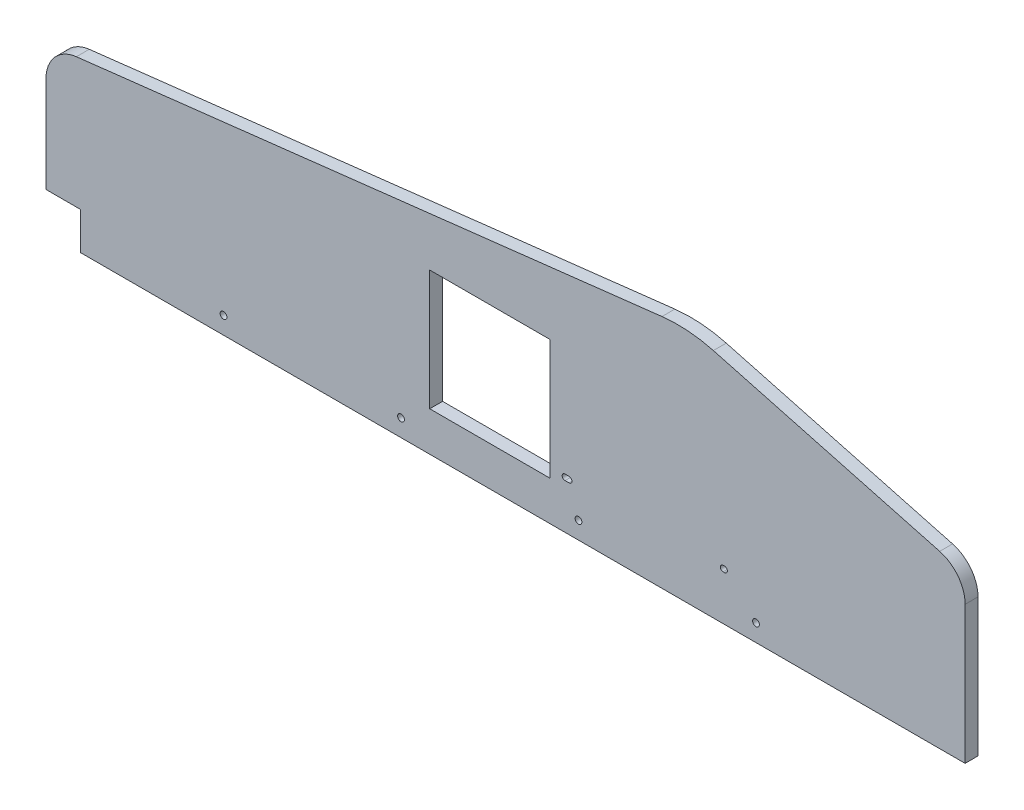
from build123d import *

# Parameters (mm, degrees)
BOSS_EXTRUDE1_DEPTH         = 4.7625
FILLET1_R                   = 25.4
FILLET2_R                   = 101.6
SKETCH3_W                   = 25.4
SKETCH3_H                   = 27.686
CUT_EXTRUDE1_DEPTH          = 383.440406717
SKETCH5_W                   = 88.9
SKETCH5_H                   = 88.9
CUT_EXTRUDE2_DEPTH          = 383.440406717
TAP_DRILL_FOR_M6X1_0_TAP1_D = 5
CUT_EXTRUDE3_DEPTH          = 383.440406717


with BuildPart() as part:
    # Sketch2 → Boss-Extrude1 (new, symmetric)
    with BuildSketch(Plane.XY):
        Polygon((-340, 26.400000032), (-340, 121.400000032), (135, 176.400000032), (340, 121.400000032), (340, 26.400000032), (340, 0), (-340, 0), align=None)
    extrude(amount=BOSS_EXTRUDE1_DEPTH, both=True)

    # Fillet1
    fillet1_edges = [part.edges().sort_by_distance(p)[0] for p in [
        (340, 121.400000032, 0),
        (-340, 121.400000032, 0),
    ]]
    fillet(fillet1_edges, radius=FILLET1_R)

    # Fillet2
    fillet2_edges = [part.edges().sort_by_distance(p)[0] for p in [
        (135, 176.400000032, 0),
    ]]
    fillet(fillet2_edges, radius=FILLET2_R)

    # Sketch3 → Cut-Extrude1 (cut, through all)
    with BuildSketch(Plane.XY.offset(4.7625)):
        with Locations((-327.3, 13.843)):
            Rectangle(SKETCH3_W, SKETCH3_H)
    extrude(amount=-CUT_EXTRUDE1_DEPTH, mode=Mode.SUBTRACT)

    # Sketch5 → Cut-Extrude2 (cut, through all)
    with BuildSketch(Plane.XY.offset(4.7625)):
        with Locations((-11.668485666, 73.5965)):
            Rectangle(SKETCH5_W, SKETCH5_H)
    extrude(amount=-CUT_EXTRUDE2_DEPTH, mode=Mode.SUBTRACT)

    # Tap Drill for M6x1.0 Tap1 (through all)
    with Locations(Plane.XY.offset(4.7625)):
        with Locations((-208.682, 12.7), (-77.364, 12.7), (53.954, 12.7), (185.272, 12.7)):
            Hole(TAP_DRILL_FOR_M6X1_0_TAP1_D / 2)

    # Sketch8 → Cut-Extrude3 (cut, through all)
    with BuildSketch(Plane.XY.offset(4.7625)):
        with BuildLine():
            Line((161, 37.4), (162, 37.4))
            ThreePointArc((162, 37.4), (164.1, 35.3), (162, 33.2))
            Line((162, 33.2), (161, 33.2))
            ThreePointArc((161, 33.2), (158.9, 35.3), (161, 37.4))
        make_face()
        with BuildLine():
            Line((47, 33.2), (44, 33.2))
            ThreePointArc((44, 33.2), (41.9, 35.3), (44, 37.4))
            Line((44, 37.4), (47, 37.4))
            ThreePointArc((47, 37.4), (49.1, 35.3), (47, 33.2))
        make_face()
    extrude(amount=-CUT_EXTRUDE3_DEPTH, mode=Mode.SUBTRACT)


solid = part.part
